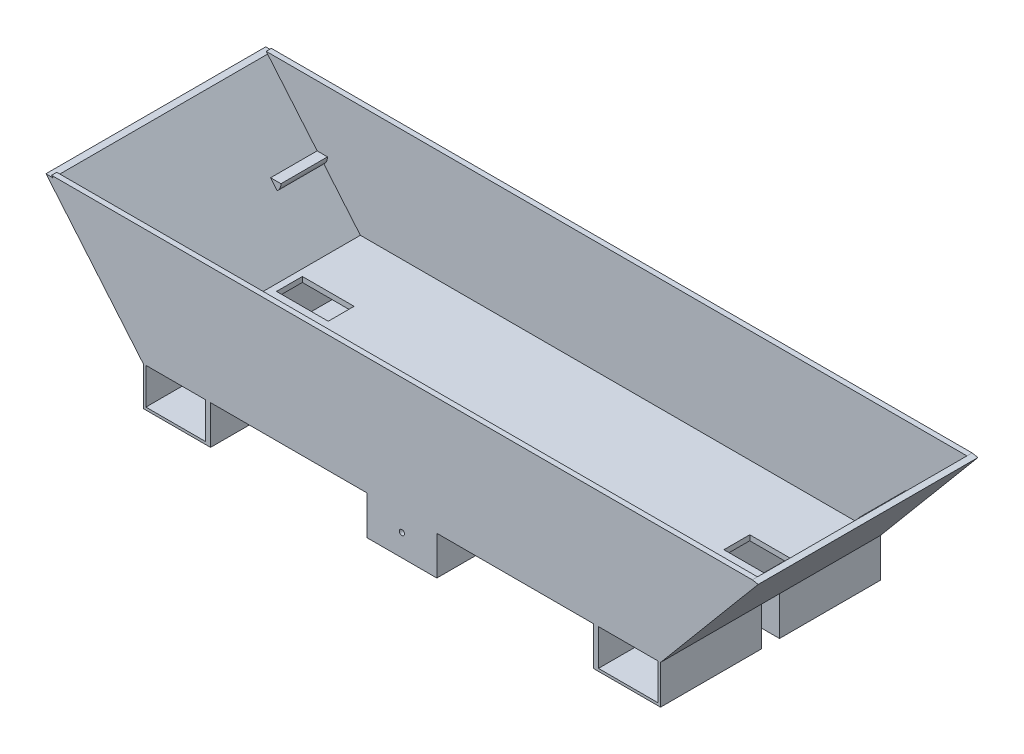
from build123d import *

# Parameters (mm, degrees)
EXTRU_MINCE3_DEPTH       = 85
EXTRU_MINCE4_DEPTH       = 14
ESQUISSE3_W              = 1
ESQUISSE3_H              = 39.023056592
EXTRU_MINCE5_DEPTH       = 14
ESQUISSE4_W              = 1
ESQUISSE4_H              = 39
EXTRU_MINCE6_DEPTH       = 14
ESQUISSE5_W              = 1
ESQUISSE5_H              = 37
EXTRU_MINCE7_DEPTH       = 14
ESQUISSE6_W              = 1
ESQUISSE6_H              = 37
EXTRU_MINCE8_DEPTH       = 14
ESQUISSE9_W              = 26
ESQUISSE9_H              = 39.023056592
ESQUISSE9_H_2            = 39
ESQUISSE9_W_2            = 27
BOSS_EXTRU_2_DEPTH       = 1
CONG_1_R                 = 10
CONG_2_R                 = 10
CONG_3_R                 = 10
CONG_4_R                 = 10
ESQUISSE10_W             = 23
ESQUISSE10_H             = 14
BOSS_EXTRU_3_DEPTH       = 3
ESQUISSE11_W             = 23
ESQUISSE11_H             = 14
BOSS_EXTRU_4_DEPTH       = 3
ESQUISSE14_R             = 1
ENL_V_MAT_EXTRU_2_DEPTH  = 15
ENL_V_START              = -15
ESQUISSE15_R             = 1
ENL_V_MAT_EXTRU_4_DEPTH  = 15
CHANFREIN2_SIZE2         = 1.154700538
CHANFREIN2_SIZE          = 2
CHANFREIN4_SIZE          = 2
CHANFREIN4_SIZE_2        = 2.22122503
BOSS_EXTRU_8_DEPTH       = 2
BOSS_EXTRU_9_DEPTH       = 2
ESQUISSE23_W             = 20
ESQUISSE23_H             = 10
ENL_V_MAT_EXTRU_7_DEPTH  = 2
ESQUISSE24_W             = 20
ESQUISSE24_H             = 10
ENL_V_MAT_EXTRU_9_DEPTH  = 2
ESQUISSE25_W             = 20
ESQUISSE25_H             = 10
ENL_V_MAT_EXTRU_11_DEPTH = 2
ESQUISSE26_W             = 20
ESQUISSE26_H             = 10
ENL_V_MAT_EXTRU_13_DEPTH = 2
ESQUISSE28_W             = 18
ESQUISSE28_H             = 4
R_VOL_MINCE9_ANGLE       = 50
ESQUISSE29_W             = 18
ESQUISSE29_H             = 4
R_VOL_MINCE10_ANGLE      = 50
ESQUISSE31_W             = 18
ESQUISSE31_H             = 4
R_VOL_MINCE11_ANGLE      = 50
ESQUISSE32_W             = 18
ESQUISSE32_H             = 4
R_VOL_MINCE12_ANGLE      = 50


# Some blends are built 0.0001 mm under size
with BuildPart() as part:
    # Esquisse1 → Extru.-Mince3 (new body)
    with BuildSketch(Plane.XY):
        Polygon((37.759483403, 45), (0, 0), (-200, 0), (-237.759483403, 45), (-236.227394517, 46.285575219), (-199.067384684, 2), (-0.932615316, 2), (36.227394517, 46.285575219), align=None)
    extrude(amount=EXTRU_MINCE3_DEPTH)

    # Esquisse2 → Extru.-Mince4 (add)
    with BuildSketch(Plane(origin=(0, 0, 0), x_dir=(-1, 0, 0), z_dir=(0, -1, 0))):
        Polygon((199.067384684, -46), (174, -46), (174, -85), (176, -85), (176, -48), (199.067384684, -48), align=None)
        Polygon((0, -48), (24, -48), (24, -85), (26, -85), (26, -46), (0, -46), align=None)
        Polygon((88.5, -85), (88.5, -48), (111.5, -48), (111.5, -85), (113.5, -85), (113.5, -46), (86.5, -46), (86.5, -85), align=None)
        Polygon((199.067384684, -37), (176, -37), (176, 0), (174, 0), (174, -39), (199.067384684, -39), align=None)
        Polygon((111.5, 0), (111.5, -37), (88.5, -37), (88.5, 0), (86.5, 0), (86.5, -39), (113.5, -39), (113.5, 0), align=None)
        Polygon((0, -39), (26, -39), (26, 0), (24, 0), (24, -37), (0, -37), align=None)
    extrude(amount=EXTRU_MINCE4_DEPTH)

    # Esquisse3 → Extru.-Mince5 (add)
    with BuildSketch(Plane(origin=(0, 0, 0), x_dir=(-1, 0, 0), z_dir=(0, -1, 0))):
        with Locations((199.5, -19.511528296)):
            Rectangle(ESQUISSE3_W, ESQUISSE3_H)
    extrude(amount=EXTRU_MINCE5_DEPTH)

    # Esquisse4 → Extru.-Mince6 (add)
    with BuildSketch(Plane.XZ):
        with Locations((-199.5, 65.5)):
            Rectangle(ESQUISSE4_W, ESQUISSE4_H)
    extrude(amount=EXTRU_MINCE6_DEPTH)

    # Esquisse5 → Extru.-Mince7 (add)
    with BuildSketch(Plane(origin=(0, 0, 0), x_dir=(-1, 0, 0), z_dir=(0, -1, 0))):
        with Locations((0.5, -18.5)):
            Rectangle(ESQUISSE5_W, ESQUISSE5_H)
    extrude(amount=EXTRU_MINCE7_DEPTH)

    # Esquisse6 → Extru.-Mince8 (add)
    with BuildSketch(Plane(origin=(0, 0, 0), x_dir=(-1, 0, 0), z_dir=(0, -1, 0))):
        with Locations((0.5, -66.5)):
            Rectangle(ESQUISSE6_W, ESQUISSE6_H)
    extrude(amount=EXTRU_MINCE8_DEPTH)

    # Esquisse9 → Boss.-Extru.2 (add)
    with BuildSketch(Plane(origin=(0, -14, 0), x_dir=(-1, 0, 0), z_dir=(0, -1, 0))):
        with Locations((187, -19.511528296)):
            Rectangle(ESQUISSE9_W, ESQUISSE9_H)
        with Locations((187, -65.5)):
            Rectangle(ESQUISSE9_W, ESQUISSE9_H_2)
        with Locations((100, -65.5)):
            Rectangle(ESQUISSE9_W_2, ESQUISSE9_H_2)
        with Locations((100, -19.5)):
            Rectangle(ESQUISSE9_W_2, ESQUISSE9_H_2)
        with Locations((13, -65.5)):
            Rectangle(ESQUISSE9_W, ESQUISSE9_H_2)
        with Locations((13, -19.5)):
            Rectangle(ESQUISSE9_W, ESQUISSE9_H_2)
    extrude(amount=BOSS_EXTRU_2_DEPTH)

    # Congé1
    cong_1_edges = [part.edges().sort_by_distance(p)[0] for p in [
        (-100, -15, 39),
    ]]
    fillet(cong_1_edges, radius=CONG_1_R)

    # Congé2
    cong_2_edges = [part.edges().sort_by_distance(p)[0] for p in [
        (-100, -14, 37),
    ]]
    fillet(cong_2_edges, radius=CONG_2_R)

    # Congé3
    cong_3_edges = [part.edges().sort_by_distance(p)[0] for p in [
        (-100, -15, 46),
    ]]
    fillet(cong_3_edges, radius=CONG_3_R)

    # Congé4
    cong_4_edges = [part.edges().sort_by_distance(p)[0] for p in [
        (-100, -14, 48),
    ]]
    fillet(cong_4_edges, radius=CONG_4_R)

    # Esquisse10 → Boss.-Extru.3 (add)
    with BuildSketch(Plane.XY.offset(85)):
        with Locations((-100, -7)):
            Rectangle(ESQUISSE10_W, ESQUISSE10_H)
    extrude(amount=-BOSS_EXTRU_3_DEPTH)

    # Esquisse11 → Boss.-Extru.4 (add)
    with BuildSketch(Plane(origin=(0, 0, 0), x_dir=(-1, 0, 0), z_dir=(0, 0, -1))):
        with Locations((100, -7)):
            Rectangle(ESQUISSE11_W, ESQUISSE11_H)
    extrude(amount=-BOSS_EXTRU_4_DEPTH)

    # Esquisse14 → Enlèv. mat.-Extru.2 (cut)
    with BuildSketch(Plane(origin=(0, 0, 0), x_dir=(-1, 0, 0), z_dir=(0, 0, -1))):
        with Locations((100, -6.5)):
            Circle(ESQUISSE14_R)
    extrude(amount=-ENL_V_MAT_EXTRU_2_DEPTH, mode=Mode.SUBTRACT)

    # Esquisse15 → Enlèv. mat.-Extru.4 (cut)
    with BuildSketch(Plane.XY.offset(85).offset(ENL_V_START)):
        with Locations(Location((-100, -6.5, 0), (0, 0, 180))):
            Circle(ESQUISSE15_R)
    extrude(amount=ENL_V_MAT_EXTRU_4_DEPTH, mode=Mode.SUBTRACT)

    # Chanfrein2
    chanfrein2_edges = [part.edges().sort_by_distance(p)[0] for p in [
        (36.227394517, 46.285575219, 42.5),
    ]]
    chanfrein2_side = [part.faces().sort_by_distance(p)[0] for p in [
        (36.245085555, 46.270730675, 42.5),
    ]]
    chamfer(chanfrein2_edges, length=CHANFREIN2_SIZE - 0.0001, length2=CHANFREIN2_SIZE2 - 0.0001, reference=chanfrein2_side[0])  # a hair under: the kernel refuses the full size

    # Chanfrein4
    # the kernel refuses this chamfer: 2.22122503, 2 mm, written as the material it takes off along each edge
    with BuildSketch(Plane(origin=(-236.227394517, 46.285575219, -5.720063061), x_dir=(0.6670048935936307, -0.7450533349513642, 0), z_dir=(0, 0, 1))) as chanfrein4_piece_1:
        Polygon((CHANFREIN4_SIZE * 0.999486448269, -CHANFREIN4_SIZE * 0.0320443400082), (-CHANFREIN4_SIZE_2 * 0.0320443400033, -CHANFREIN4_SIZE_2 * 0.999486448115), (0, 0), align=None)
    extrude(amount=96.440126123, mode=Mode.SUBTRACT)

    # Esquisse17 → Boss.-Extru.8 (add)
    with BuildSketch(Plane.XY.offset(85)):
        Polygon((35.485167318, 45.401023288), (-235.485167318, 45.401023288), (-199.067384684, 2), (-0.932615316, 2), align=None)
    extrude(amount=-BOSS_EXTRU_8_DEPTH)

    # Esquisse18 → Boss.-Extru.9 (add)
    with BuildSketch(Plane(origin=(0, 0, 0), x_dir=(-1, 0, 0), z_dir=(0, 0, -1))):
        Polygon((-35.485167318, 45.401023288), (235.485167318, 45.401023288), (199.067384684, 2), (0.932615316, 2), align=None)
    extrude(amount=-BOSS_EXTRU_9_DEPTH)

    # Esquisse23 → Enlèv. mat.-Extru.7 (cut)
    with BuildSketch(Plane(origin=(0, 0, 0), x_dir=(-1, 0, 0), z_dir=(0, -1, 0))):
        with Locations((13.5, -32)):
            Rectangle(ESQUISSE23_W, ESQUISSE23_H)
    extrude(amount=-ENL_V_MAT_EXTRU_7_DEPTH, mode=Mode.SUBTRACT)

    # Esquisse24 → Enlèv. mat.-Extru.9 (cut)
    with BuildSketch(Plane.XZ):
        with Locations((-13.5, 53)):
            Rectangle(ESQUISSE24_W, ESQUISSE24_H)
    extrude(amount=-ENL_V_MAT_EXTRU_9_DEPTH, mode=Mode.SUBTRACT)

    # Esquisse25 → Enlèv. mat.-Extru.11 (cut)
    with BuildSketch(Plane(origin=(0, 0, 0), x_dir=(-1, 0, 0), z_dir=(0, -1, 0))):
        with Locations((186.5, -53)):
            Rectangle(ESQUISSE25_W, ESQUISSE25_H)
    extrude(amount=-ENL_V_MAT_EXTRU_11_DEPTH, mode=Mode.SUBTRACT)

    # Esquisse26 → Enlèv. mat.-Extru.13 (cut)
    with BuildSketch(Plane(origin=(0, 0, 0), x_dir=(-1, 0, 0), z_dir=(0, -1, 0))):
        with Locations((186.5, -32)):
            Rectangle(ESQUISSE26_W, ESQUISSE26_H)
    extrude(amount=-ENL_V_MAT_EXTRU_13_DEPTH, mode=Mode.SUBTRACT)

    # Esquisse28 → Révol.-Mince9 (revolve)
    with BuildSketch(Plane(origin=(-115.83272888, -97.195200082, 0), x_dir=(0, 0, -1), z_dir=(0.7660444431189792, 0.6427876096865379, 0))):
        with Locations((-74.044453546, 153.490137254)):
            Rectangle(ESQUISSE28_W, ESQUISSE28_H)
    revolve(axis=Axis((-215.779862536, 21.917155521, 83.044453546), (0, 0, 1)), revolution_arc=R_VOL_MINCE9_ANGLE)

    # Esquisse29 → Révol.-Mince10 (revolve)
    with BuildSketch(Plane(origin=(-115.83272888, -97.195200082, 0), x_dir=(0, 0, -1), z_dir=(0.7660444431189792, 0.6427876096865379, 0))):
        with Locations((-11, 153.490137254)):
            Rectangle(ESQUISSE29_W, ESQUISSE29_H)
    revolve(axis=Axis((-215.779862536, 21.917155521, 2), (0, 0, 1)), revolution_arc=R_VOL_MINCE10_ANGLE)

    # Esquisse31 → Révol.-Mince11 (revolve)
    with BuildSketch(Plane(origin=(-1.532088886, 1.285575219, 0), x_dir=(0, 0, 1), z_dir=(-0.7660444431189749, 0.642787609686543, 0))):
        with Locations((11, 24.932615316)):
            Rectangle(ESQUISSE31_W, ESQUISSE31_H)
    revolve(axis=Axis((15.779862536, 21.917155521, 2), (0, 0, -1)), revolution_arc=R_VOL_MINCE11_ANGLE)

    # Esquisse32 → Révol.-Mince12 (revolve)
    with BuildSketch(Plane(origin=(-1.532088886, 1.285575219, 0), x_dir=(0, 0, 1), z_dir=(-0.7660444431189749, 0.642787609686543, 0))):
        with Locations((74, 24.932615316)):
            Rectangle(ESQUISSE32_W, ESQUISSE32_H)
    revolve(axis=Axis((15.779862536, 21.917155521, 83), (0, 0, -1)), revolution_arc=R_VOL_MINCE12_ANGLE)


solid = part.part
